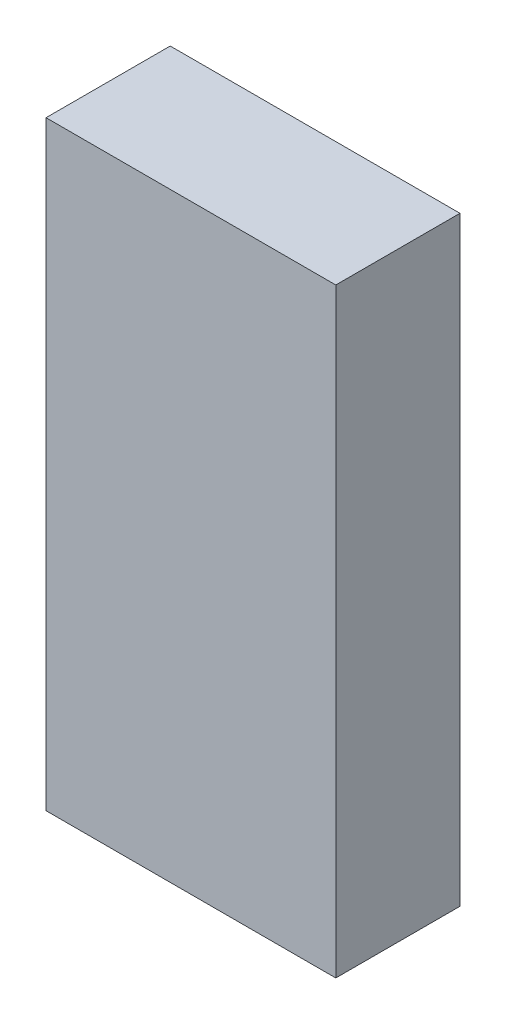
from build123d import *

# Parameters (mm, degrees)
SKETCH1_W           = 14
SKETCH1_H           = 29
BOSS_EXTRUDE1_DEPTH = 6


with BuildPart() as part:
    # Sketch1 → Boss-Extrude1 (new body)
    with BuildSketch(Plane.XY):
        with Locations((7, 14.5)):
            Rectangle(SKETCH1_W, SKETCH1_H)
    extrude(amount=BOSS_EXTRUDE1_DEPTH)


solid = part.part
